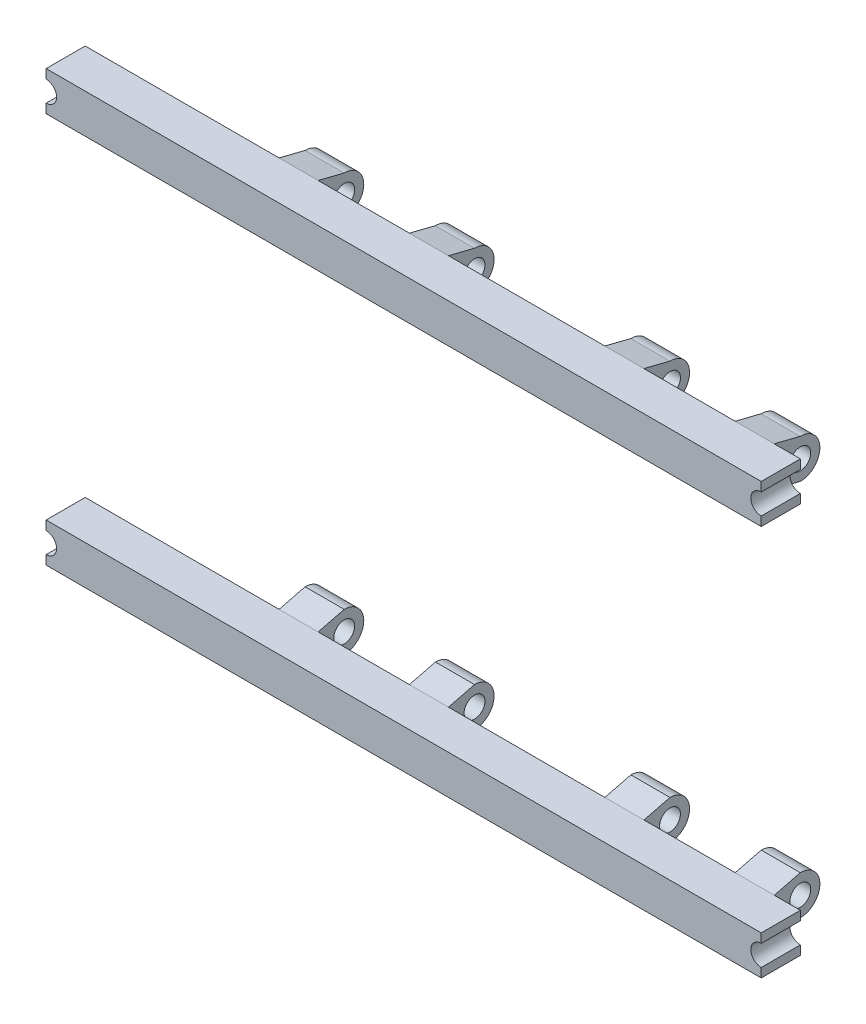
from build123d import *

# Parameters (mm, degrees)
SKETCH1_W             = 109.75
SKETCH1_H             = 6
BOSS_EXTRUDE1_DEPTH   = 6
BOSS_EXTRUDE1_2_DEPTH = 6
BOSS_EXTRUDE2_START   = -4
SKETCH2_R             = 1.6
BOSS_EXTRUDE2_DEPTH   = 6
LPATTERN1_COUNT       = 8
LPATTERN1_PITCH       = 10
CUT_EXTRUDE1_REACH    = 249.551
SKETCH3_R             = 1.6


with BuildPart() as part:
    # Sketch1 → Boss-Extrude1 (new body)
    with BuildSketch(Plane.XY):
        with Locations((57.875, -217)):
            Rectangle(SKETCH1_W, SKETCH1_H)
    extrude(amount=-BOSS_EXTRUDE1_DEPTH)



with BuildPart() as body_2:
    # Sketch1 → Boss-Extrude1 2 (new body)
    with BuildSketch(Plane.XY):
        with Locations((57.875, -157)):
            Rectangle(SKETCH1_W, SKETCH1_H)
    extrude(amount=-BOSS_EXTRUDE1_2_DEPTH)


with BuildPart() as part_1:
    add(part.part)

    add(body_2.part)  # Boss-Extrude2 merges body 2
    # Sketch2 → Boss-Extrude2 (add)
    # profile 1 of 2: a face of its own
    with BuildSketch(Plane(origin=(112.75, 0, 0), x_dir=(0, 0, -1), z_dir=(1, 0, 0)).offset(BOSS_EXTRUDE2_START)):
        with BuildLine():
            Line((6, -214), (6, -220))
            Line((6, -220), (10, -219))
            ThreePointArc((10, -219), (13, -216), (10, -213))
            Line((10, -213), (6, -214))
        make_face()
        with Locations((10, -216)):
            Circle(SKETCH2_R, mode=Mode.SUBTRACT)
    # profile 2 of 2: a face of its own
    with BuildSketch(Plane(origin=(112.75, 0, 0), x_dir=(0, 0, -1), z_dir=(1, 0, 0)).offset(BOSS_EXTRUDE2_START)):
        with BuildLine():
            Line((10, -155), (6, -154))
            Line((6, -154), (6, -160))
            Line((6, -160), (10, -161))
            ThreePointArc((10, -161), (13, -158), (10, -155))
        make_face()
        with Locations((10, -158)):
            Circle(SKETCH2_R, mode=Mode.SUBTRACT)
    boss_extrude2 = extrude(amount=-BOSS_EXTRUDE2_DEPTH)

    # LPattern1: Boss-Extrude2 ×8, 4 skipped
    with Locations(*[(-i * LPATTERN1_PITCH, 0, 0) for i in range(1, LPATTERN1_COUNT) if i not in (1, 3, 4, 6)]):
        add(boss_extrude2)

    # Sketch3 → Cut-Extrude1 (cut, up to next)
    with BuildSketch(Plane.XY, mode=Mode.PRIVATE) as cut_extrude1_sk1:
        with Locations((3, -217)):
            Circle(SKETCH3_R)
    cut_extrude1_tool1 = extrude(cut_extrude1_sk1.sketch, amount=-CUT_EXTRUDE1_REACH, mode=Mode.PRIVATE) & part_1.part
    # Sketch3 → Cut-Extrude1 (cut, up to next)
    with BuildSketch(Plane.XY, mode=Mode.PRIVATE) as cut_extrude1_sk2:
        with Locations((3, -157)):
            Circle(SKETCH3_R)
    cut_extrude1_tool2 = extrude(cut_extrude1_sk2.sketch, amount=-CUT_EXTRUDE1_REACH, mode=Mode.PRIVATE) & part_1.part
    # Sketch3 → Cut-Extrude1 (cut, up to next)
    with BuildSketch(Plane.XY, mode=Mode.PRIVATE) as cut_extrude1_sk3:
        with Locations((112.75, -157)):
            Circle(SKETCH3_R)
    cut_extrude1_tool3 = extrude(cut_extrude1_sk3.sketch, amount=-CUT_EXTRUDE1_REACH, mode=Mode.PRIVATE) & part_1.part
    # Sketch3 → Cut-Extrude1 (cut, up to next)
    with BuildSketch(Plane.XY, mode=Mode.PRIVATE) as cut_extrude1_sk4:
        with Locations((112.75, -217)):
            Circle(SKETCH3_R)
    cut_extrude1_tool4 = extrude(cut_extrude1_sk4.sketch, amount=-CUT_EXTRUDE1_REACH, mode=Mode.PRIVATE) & part_1.part
    add(cut_extrude1_tool1.solids().sort_by_distance((3, -217, 0))[0], mode=Mode.SUBTRACT)
    add(cut_extrude1_tool2.solids().sort_by_distance((3, -157, 0))[0], mode=Mode.SUBTRACT)
    add(cut_extrude1_tool3.solids().sort_by_distance((112.75, -157, 0))[0], mode=Mode.SUBTRACT)
    add(cut_extrude1_tool4.solids().sort_by_distance((112.75, -217, 0))[0], mode=Mode.SUBTRACT)


solid = part_1.part
